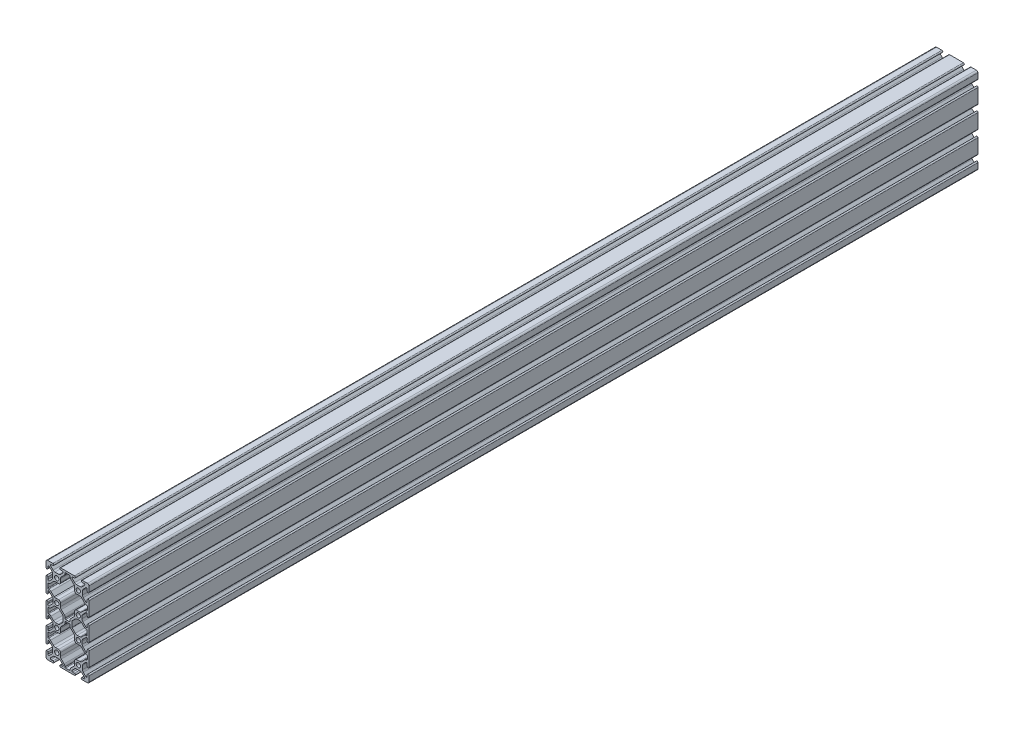
from build123d import *

# Parameters (mm, degrees)
SKETCH1_R      = 2.5
EXTRUDE1_DEPTH = 1031.646


with BuildPart() as part:
    # Sketch1 → Extrude1 (new body)
    with BuildSketch(Plane.XY):
        with BuildLine():
            Line((-8.202452575, 43.310755937), (-5.238252772, 46.27495574))
            ThreePointArc((-5.238252772, 46.27495574), (-5.03697983, 47.286823153), (-5.894799602, 47.86))
            Line((-5.894799602, 47.86), (-8.02436974, 47.86))
            ThreePointArc((-8.02436974, 47.86), (-9.09436974, 48.93), (-8.02436974, 50))
            Line((-8.02436974, 50), (-2.315834377, 50))
            Line((-2.315834377, 50), (2.315834377, 50))
            Line((2.315834377, 50), (8.02436974, 50))
            ThreePointArc((8.02436974, 50), (9.09436974, 48.93), (8.02436974, 47.86))
            Line((8.02436974, 47.86), (5.894799602, 47.86))
            ThreePointArc((5.894799602, 47.86), (5.03697983, 47.286823153), (5.238252772, 46.27495574))
            Line((5.238252772, 46.27495574), (8.202452575, 43.310755937))
            ThreePointArc((8.202452575, 43.310755937), (9.157595011, 42.672550862), (10.284262293, 42.448444577))
            Line((10.284262293, 42.448444577), (14.708234998, 42.448454152))
            ThreePointArc((14.708234998, 42.448454152), (15.83893827, 42.671117491), (16.797547425, 43.310755937))
            Line((16.797547425, 43.310755937), (19.761747228, 46.27495574))
            ThreePointArc((19.761747228, 46.27495574), (19.96302017, 47.286823153), (19.105200398, 47.86))
            Line((19.105200398, 47.86), (16.97563026, 47.86))
            ThreePointArc((16.97563026, 47.86), (15.90563026, 48.93), (16.97563026, 50))
            Line((16.97563026, 50), (21.758832238, 50))
            Line((21.758832238, 50), (23.041124805, 50))
            ThreePointArc((23.041124805, 50), (24.332005248, 49.521885571), (25, 48.318245783))
            Line((25, 48.318245783), (25, 42.082202669))
            ThreePointArc((25, 42.082202669), (23.93, 41.012202669), (22.86, 42.082202669))
            Line((22.86, 42.082202669), (22.86, 44.211772807))
            ThreePointArc((22.86, 44.211772807), (22.13773437, 44.916244594), (21.164272753, 44.651064241))
            Line((21.164272753, 44.651064241), (18.327918757, 41.814710246))
            ThreePointArc((18.327918757, 41.814710246), (17.639489034, 40.784402354), (17.397744663, 39.569071332))
            Line((17.397744663, 39.569071332), (17.397744663, 35.430928668))
            ThreePointArc((17.397744663, 35.430928668), (17.639489034, 34.215597646), (18.327918757, 33.185289754))
            Line((18.327918757, 33.185289754), (21.127116553, 30.386091959))
            ThreePointArc((21.127116553, 30.386091959), (22.233362186, 30.166046021), (22.86, 31.103875784))
            Line((22.86, 31.103875784), (22.86, 33.442202669))
            ThreePointArc((22.86, 33.442202669), (23.93, 34.512202669), (25, 33.442202669))
            Line((25, 33.442202669), (25, 29.299008941))
            Line((25, 29.299008941), (25, 21.219740648))
            Line((25, 21.219740648), (25, 17.040370729))
            ThreePointArc((25, 17.040370729), (23.904333588, 15.955956055), (22.86646371, 17.095809637))
            Line((22.86646371, 17.095809637), (22.86646371, 19.489411218))
            ThreePointArc((22.86646371, 19.489411218), (22.119482528, 20.02126145), (21.24830289, 19.735094378))
            Line((21.24830289, 19.735094378), (17.927013012, 16.4138045))
            ThreePointArc((17.927013012, 16.4138045), (17.222742213, 15.542217138), (16.865021315, 14.480286045))
            Line((16.865021315, 14.480286045), (16.865021315, 11.373754622))
            ThreePointArc((16.865021315, 11.373754622), (17.006264756, 9.974657926), (17.737790465, 8.77370355))
            Line((17.737790465, 8.77370355), (21.060805533, 5.450688482))
            ThreePointArc((21.060805533, 5.450688482), (22.48261952, 5.067456017), (22.865851985, 6.489270005))
            Line((22.865851985, 6.489270005), (22.865851985, 8.266111582))
            ThreePointArc((22.865851985, 8.266111582), (23.927171289, 9.338940293), (25, 8.277620989))
            Line((25, 8.277620989), (25, 3.7699517))
            Line((25, 3.7699517), (25, -3.7699517))
            Line((25, -3.7699517), (25, -8.277620989))
            ThreePointArc((25, -8.277620989), (23.927171289, -9.338940293), (22.865851985, -8.266111582))
            Line((22.865851985, -8.266111582), (22.865851985, -6.489270005))
            ThreePointArc((22.865851985, -6.489270005), (22.48261952, -5.067456017), (21.060805533, -5.450688482))
            Line((21.060805533, -5.450688482), (17.737790465, -8.77370355))
            ThreePointArc((17.737790465, -8.77370355), (17.006264756, -9.974657926), (16.865021315, -11.373754622))
            Line((16.865021315, -11.373754622), (16.865021315, -14.480286045))
            ThreePointArc((16.865021315, -14.480286045), (17.222742213, -15.542217138), (17.927013012, -16.4138045))
            Line((17.927013012, -16.4138045), (21.24830289, -19.735094378))
            ThreePointArc((21.24830289, -19.735094378), (22.119482528, -20.02126145), (22.86646371, -19.489411218))
            Line((22.86646371, -19.489411218), (22.86646371, -17.095809637))
            ThreePointArc((22.86646371, -17.095809637), (23.904333588, -15.955956055), (25, -17.040370729))
            Line((25, -17.040370729), (25, -21.219740648))
            Line((25, -21.219740648), (25, -29.299008941))
            Line((25, -29.299008941), (25, -33.442202669))
            ThreePointArc((25, -33.442202669), (23.93, -34.512202669), (22.86, -33.442202669))
            Line((22.86, -33.442202669), (22.86, -31.103875784))
            ThreePointArc((22.86, -31.103875784), (22.233362186, -30.166046021), (21.127116553, -30.386091959))
            Line((21.127116553, -30.386091959), (18.327918757, -33.185289754))
            ThreePointArc((18.327918757, -33.185289754), (17.639489034, -34.215597646), (17.397744663, -35.430928668))
            Line((17.397744663, -35.430928668), (17.397744663, -39.569071332))
            ThreePointArc((17.397744663, -39.569071332), (17.639489034, -40.784402354), (18.327918757, -41.814710246))
            Line((18.327918757, -41.814710246), (21.164272753, -44.651064241))
            ThreePointArc((21.164272753, -44.651064241), (22.13773437, -44.916244594), (22.86, -44.211772807))
            Line((22.86, -44.211772807), (22.86, -42.082202669))
            ThreePointArc((22.86, -42.082202669), (23.93, -41.012202669), (25, -42.082202669))
            Line((25, -42.082202669), (25, -48.318245783))
            ThreePointArc((25, -48.318245783), (24.332005248, -49.521885571), (23.041124805, -50))
            Line((23.041124805, -50), (21.758832238, -50))
            Line((21.758832238, -50), (16.97563026, -50))
            ThreePointArc((16.97563026, -50), (15.90563026, -48.93), (16.97563026, -47.86))
            Line((16.97563026, -47.86), (19.105200398, -47.86))
            ThreePointArc((19.105200398, -47.86), (19.96302017, -47.286823153), (19.761747228, -46.27495574))
            Line((19.761747228, -46.27495574), (16.797547425, -43.310755937))
            ThreePointArc((16.797547425, -43.310755937), (15.83893827, -42.671117491), (14.708234998, -42.448454152))
            Line((14.708234998, -42.448454152), (10.284262293, -42.448444577))
            ThreePointArc((10.284262293, -42.448444577), (9.157595011, -42.672550862), (8.202452575, -43.310755937))
            Line((8.202452575, -43.310755937), (5.238252772, -46.27495574))
            ThreePointArc((5.238252772, -46.27495574), (5.03697983, -47.286823153), (5.894799602, -47.86))
            Line((5.894799602, -47.86), (8.02436974, -47.86))
            ThreePointArc((8.02436974, -47.86), (9.09436974, -48.93), (8.02436974, -50))
            Line((8.02436974, -50), (2.315834377, -50))
            Line((2.315834377, -50), (-2.315834377, -50))
            Line((-2.315834377, -50), (-8.02436974, -50))
            ThreePointArc((-8.02436974, -50), (-9.09436974, -48.93), (-8.02436974, -47.86))
            Line((-8.02436974, -47.86), (-5.894799602, -47.86))
            ThreePointArc((-5.894799602, -47.86), (-5.03697983, -47.286823153), (-5.238252772, -46.27495574))
            Line((-5.238252772, -46.27495574), (-8.202452575, -43.310755937))
            ThreePointArc((-8.202452575, -43.310755937), (-9.157595011, -42.672550862), (-10.284262293, -42.448444577))
            Line((-10.284262293, -42.448444577), (-14.708234998, -42.448454152))
            ThreePointArc((-14.708234998, -42.448454152), (-15.83893827, -42.671117491), (-16.797547425, -43.310755937))
            Line((-16.797547425, -43.310755937), (-19.761747228, -46.27495574))
            ThreePointArc((-19.761747228, -46.27495574), (-19.96302017, -47.286823153), (-19.105200398, -47.86))
            Line((-19.105200398, -47.86), (-16.97563026, -47.86))
            ThreePointArc((-16.97563026, -47.86), (-15.90563026, -48.93), (-16.97563026, -50))
            Line((-16.97563026, -50), (-23.041124805, -50))
            ThreePointArc((-23.041124805, -50), (-24.332005248, -49.521885571), (-25, -48.318245783))
            Line((-25, -48.318245783), (-25, -42.082202669))
            ThreePointArc((-25, -42.082202669), (-23.93, -41.012202669), (-22.86, -42.082202669))
            Line((-22.86, -42.082202669), (-22.86, -44.211772807))
            ThreePointArc((-22.86, -44.211772807), (-22.13773437, -44.916244594), (-21.164272753, -44.651064241))
            Line((-21.164272753, -44.651064241), (-18.327918757, -41.814710246))
            ThreePointArc((-18.327918757, -41.814710246), (-17.639489034, -40.784402354), (-17.397744663, -39.569071332))
            Line((-17.397744663, -39.569071332), (-17.397744663, -35.430928668))
            ThreePointArc((-17.397744663, -35.430928668), (-17.639489034, -34.215597646), (-18.327918757, -33.185289754))
            Line((-18.327918757, -33.185289754), (-21.127116553, -30.386091959))
            ThreePointArc((-21.127116553, -30.386091959), (-22.233362186, -30.166046021), (-22.86, -31.103875784))
            Line((-22.86, -31.103875784), (-22.86, -33.442202669))
            ThreePointArc((-22.86, -33.442202669), (-23.93, -34.512202669), (-25, -33.442202669))
            Line((-25, -33.442202669), (-25, -29.299008941))
            Line((-25, -29.299008941), (-25, -21.219740648))
            Line((-25, -21.219740648), (-25, -17.040370729))
            ThreePointArc((-25, -17.040370729), (-23.904333588, -15.955956055), (-22.86646371, -17.095809637))
            Line((-22.86646371, -17.095809637), (-22.86646371, -19.489411218))
            ThreePointArc((-22.86646371, -19.489411218), (-22.119482528, -20.02126145), (-21.24830289, -19.735094378))
            Line((-21.24830289, -19.735094378), (-17.927013012, -16.4138045))
            ThreePointArc((-17.927013012, -16.4138045), (-17.222742213, -15.542217138), (-16.865021315, -14.480286045))
            Line((-16.865021315, -14.480286045), (-16.865021315, -11.373754622))
            ThreePointArc((-16.865021315, -11.373754622), (-17.006264756, -9.974657926), (-17.737790465, -8.77370355))
            Line((-17.737790465, -8.77370355), (-21.060805533, -5.450688482))
            ThreePointArc((-21.060805533, -5.450688482), (-22.48261952, -5.067456017), (-22.865851985, -6.489270005))
            Line((-22.865851985, -6.489270005), (-22.865851985, -8.266111582))
            ThreePointArc((-22.865851985, -8.266111582), (-23.927171289, -9.338940293), (-25, -8.277620989))
            Line((-25, -8.277620989), (-25, -3.7699517))
            Line((-25, -3.7699517), (-25, 3.7699517))
            Line((-25, 3.7699517), (-25, 8.277620989))
            ThreePointArc((-25, 8.277620989), (-23.927171289, 9.338940293), (-22.865851985, 8.266111582))
            Line((-22.865851985, 8.266111582), (-22.865851985, 6.489270005))
            ThreePointArc((-22.865851985, 6.489270005), (-22.48261952, 5.067456017), (-21.060805533, 5.450688482))
            Line((-21.060805533, 5.450688482), (-17.737790465, 8.77370355))
            ThreePointArc((-17.737790465, 8.77370355), (-17.006264756, 9.974657926), (-16.865021315, 11.373754622))
            Line((-16.865021315, 11.373754622), (-16.865021315, 14.480286045))
            ThreePointArc((-16.865021315, 14.480286045), (-17.222742213, 15.542217138), (-17.927013012, 16.4138045))
            Line((-17.927013012, 16.4138045), (-21.24830289, 19.735094378))
            ThreePointArc((-21.24830289, 19.735094378), (-22.119482528, 20.02126145), (-22.86646371, 19.489411218))
            Line((-22.86646371, 19.489411218), (-22.86646371, 17.095809637))
            ThreePointArc((-22.86646371, 17.095809637), (-23.904333588, 15.955956055), (-25, 17.040370729))
            Line((-25, 17.040370729), (-25, 21.219740648))
            Line((-25, 21.219740648), (-25, 29.299008941))
            Line((-25, 29.299008941), (-25, 33.442202669))
            ThreePointArc((-25, 33.442202669), (-23.93, 34.512202669), (-22.86, 33.442202669))
            Line((-22.86, 33.442202669), (-22.86, 31.103875784))
            ThreePointArc((-22.86, 31.103875784), (-22.233362186, 30.166046021), (-21.127116553, 30.386091959))
            Line((-21.127116553, 30.386091959), (-18.327918757, 33.185289754))
            ThreePointArc((-18.327918757, 33.185289754), (-17.639489034, 34.215597646), (-17.397744663, 35.430928668))
            Line((-17.397744663, 35.430928668), (-17.397744663, 39.569071332))
            ThreePointArc((-17.397744663, 39.569071332), (-17.639489034, 40.784402354), (-18.327918757, 41.814710246))
            Line((-18.327918757, 41.814710246), (-21.164272753, 44.651064241))
            ThreePointArc((-21.164272753, 44.651064241), (-22.13773437, 44.916244594), (-22.86, 44.211772807))
            Line((-22.86, 44.211772807), (-22.86, 42.082202669))
            ThreePointArc((-22.86, 42.082202669), (-23.93, 41.012202669), (-25, 42.082202669))
            Line((-25, 42.082202669), (-25, 48.318245783))
            ThreePointArc((-25, 48.318245783), (-24.332005248, 49.521885571), (-23.041124805, 50))
            Line((-23.041124805, 50), (-16.97563026, 50))
            ThreePointArc((-16.97563026, 50), (-15.90563026, 48.93), (-16.97563026, 47.86))
            Line((-16.97563026, 47.86), (-19.105200398, 47.86))
            ThreePointArc((-19.105200398, 47.86), (-19.96302017, 47.286823153), (-19.761747228, 46.27495574))
            Line((-19.761747228, 46.27495574), (-16.797547425, 43.310755937))
            ThreePointArc((-16.797547425, 43.310755937), (-15.83893827, 42.671117491), (-14.708234998, 42.448454152))
            Line((-14.708234998, 42.448454152), (-10.284262293, 42.448444577))
            ThreePointArc((-10.284262293, 42.448444577), (-9.157595011, 42.672550862), (-8.202452575, 43.310755937))
        make_face()
        with Locations((-12.5, 12.5)):
            Circle(SKETCH1_R, mode=Mode.SUBTRACT)
        with Locations((-12.5, 37.5)):
            Circle(SKETCH1_R, mode=Mode.SUBTRACT)
        with Locations((12.5, -12.5)):
            Circle(SKETCH1_R, mode=Mode.SUBTRACT)
        with Locations((12.5, -37.5)):
            Circle(SKETCH1_R, mode=Mode.SUBTRACT)
        with Locations((-12.5, -37.5)):
            Circle(SKETCH1_R, mode=Mode.SUBTRACT)
        with Locations((-12.5, -12.5)):
            Circle(SKETCH1_R, mode=Mode.SUBTRACT)
        with Locations((12.5, 37.5)):
            Circle(SKETCH1_R, mode=Mode.SUBTRACT)
        with Locations((12.5, 12.5)):
            Circle(SKETCH1_R, mode=Mode.SUBTRACT)
        with BuildLine():
            Line((-8.185773444, 12.487513796), (-8.185773444, 11.011393555))
            ThreePointArc((-8.185773444, 11.011393555), (-8.008609194, 9.643792267), (-7.268461542, 8.480219361))
            Line((-7.268461542, 8.480219361), (-3.754938975, 4.966696794))
            ThreePointArc((-3.754938975, 4.966696794), (-3.063534403, 3.923946022), (-2.832523582, 2.694310526))
            Line((-2.832523582, 2.694310526), (-2.832523582, 1.819708918))
            ThreePointArc((-2.832523582, 1.819708918), (-2.609281799, 1.280755579), (-2.07032846, 1.057513796))
            Line((-2.07032846, 1.057513796), (2.072320044, 1.057513796))
            ThreePointArc((2.072320044, 1.057513796), (2.611273383, 1.280755579), (2.834515166, 1.819708918))
            Line((2.834515166, 1.819708918), (2.834515166, 2.694310526))
            ThreePointArc((2.834515166, 2.694310526), (3.065525987, 3.923946022), (3.756930558, 4.966696794))
            Line((3.756930558, 4.966696794), (7.270453125, 8.480219361))
            ThreePointArc((7.270453125, 8.480219361), (8.010600778, 9.643792267), (8.187765028, 11.011393555))
            Line((8.187765028, 11.011393555), (8.187765028, 14.589100627))
            ThreePointArc((8.187765028, 14.589100627), (8.835059042, 16.151806613), (10.397765028, 16.799100627))
            Line((10.397765028, 16.799100627), (14.322526745, 16.799100627))
            ThreePointArc((14.322526745, 16.799100627), (14.978333775, 16.883638222), (15.602419985, 17.102146501))
            Line((15.602419985, 17.102146501), (19.298207918, 20.797934434))
            ThreePointArc((19.298207918, 20.797934434), (20.326629934, 21.485104056), (21.539736414, 21.726405938))
            Line((21.539736414, 21.726405938), (22.112655364, 21.726405938))
            ThreePointArc((22.112655364, 21.726405938), (22.651608703, 21.94964772), (22.874850486, 22.488601059))
            Line((22.874850486, 22.488601059), (22.874850486, 26.856767325))
            ThreePointArc((22.874850486, 26.856767325), (22.653840578, 27.386829201), (22.125606626, 27.612173081))
            Line((22.125606626, 27.612173081), (21.871541586, 27.612173081))
            ThreePointArc((21.871541586, 27.612173081), (20.717547023, 27.958593442), (19.776177785, 28.710613704))
            Line((19.776177785, 28.710613704), (16.387363346, 32.099428142))
            ThreePointArc((16.387363346, 32.099428142), (15.195987364, 32.790442646), (13.839798728, 33.030505467))
            Line((13.839798728, 33.030505467), (10.362350257, 33.030505467))
            ThreePointArc((10.362350257, 33.030505467), (8.799644271, 33.67779948), (8.152350257, 35.240505467))
            Line((8.152350257, 35.240505467), (8.152350257, 39.051208905))
            ThreePointArc((8.152350257, 39.051208905), (7.904533851, 40.249092372), (7.222341418, 41.26445007))
            Line((7.222341418, 41.26445007), (4.012209831, 44.474581658))
            ThreePointArc((4.012209831, 44.474581658), (3.329287545, 45.496647086), (3.089477129, 46.70225546))
            Line((3.089477129, 46.70225546), (3.089477129, 47.097840517))
            ThreePointArc((3.089477129, 47.097840517), (2.866245785, 47.636768656), (2.327317646, 47.86))
            Line((2.327317646, 47.86), (0, 47.86))
            Line((0, 47.86), (-2.327317646, 47.86))
            ThreePointArc((-2.327317646, 47.86), (-2.866245785, 47.636768656), (-3.089477129, 47.097840517))
            Line((-3.089477129, 47.097840517), (-3.089477129, 46.70225546))
            ThreePointArc((-3.089477129, 46.70225546), (-3.329287545, 45.496647086), (-4.012209831, 44.474581658))
            Line((-4.012209831, 44.474581658), (-7.222341418, 41.26445007))
            ThreePointArc((-7.222341418, 41.26445007), (-7.904533851, 40.249092372), (-8.152350257, 39.051208905))
            Line((-8.152350257, 39.051208905), (-8.152350257, 35.240505467))
            ThreePointArc((-8.152350257, 35.240505467), (-8.799644271, 33.67779948), (-10.362350257, 33.030505467))
            Line((-10.362350257, 33.030505467), (-10.389864765, 33.030505467))
            Line((-10.389864765, 33.030505467), (-13.839798728, 33.030505467))
            ThreePointArc((-13.839798728, 33.030505467), (-15.195987364, 32.790442646), (-16.387363346, 32.099428142))
            Line((-16.387363346, 32.099428142), (-19.776177785, 28.710613704))
            ThreePointArc((-19.776177785, 28.710613704), (-20.711520847, 27.964936369), (-21.856598739, 27.618962447))
            Line((-21.856598739, 27.618962447), (-22.11066378, 27.618962447))
            ThreePointArc((-22.11066378, 27.618962447), (-22.649617119, 27.395720665), (-22.872858902, 26.856767325))
            Line((-22.872858902, 26.856767325), (-22.872858902, 22.488601059))
            ThreePointArc((-22.872858902, 22.488601059), (-22.649617119, 21.94964772), (-22.11066378, 21.726405938))
            Line((-22.11066378, 21.726405938), (-21.537744831, 21.726405938))
            ThreePointArc((-21.537744831, 21.726405938), (-20.32463835, 21.485104056), (-19.296216334, 20.797934434))
            Line((-19.296216334, 20.797934434), (-15.600428402, 17.102146501))
            ThreePointArc((-15.600428402, 17.102146501), (-14.976342192, 16.883638222), (-14.320535162, 16.799100627))
            Line((-14.320535162, 16.799100627), (-10.395773444, 16.799100627))
            ThreePointArc((-10.395773444, 16.799100627), (-8.833067458, 16.151806613), (-8.185773444, 14.589100627))
            Line((-8.185773444, 14.589100627), (-8.185773444, 12.487513796))
        make_face(mode=Mode.SUBTRACT)
        with BuildLine():
            Line((-22.86, 2.484036233), (-22.86, -2.484036233))
            ThreePointArc((-22.86, -2.484036233), (-22.636758217, -3.022989573), (-22.097804878, -3.246231355))
            Line((-22.097804878, -3.246231355), (-21.843739837, -3.246231355))
            ThreePointArc((-21.843739837, -3.246231355), (-20.485171192, -3.421032102), (-19.329200619, -4.155876372))
            Line((-19.329200619, -4.155876372), (-16.293050967, -7.192026025))
            ThreePointArc((-16.293050967, -7.192026025), (-15.262743076, -7.880455748), (-14.047412053, -8.122200119))
            Line((-14.047412053, -8.122200119), (-11.24083373, -8.122200119))
            ThreePointArc((-11.24083373, -8.122200119), (-10.025502708, -7.880455748), (-8.995194816, -7.192026025))
            Line((-8.995194816, -7.192026025), (-5.327964206, -3.524795414))
            ThreePointArc((-5.327964206, -3.524795414), (-5.186657366, -3.313314782), (-5.137037002, -3.063856368))
            Line((-5.137037002, -3.063856368), (-5.137037002, 3.063856368))
            ThreePointArc((-5.137037002, 3.063856368), (-5.186657366, 3.313314782), (-5.327964206, 3.524795414))
            Line((-5.327964206, 3.524795414), (-8.995194816, 7.192026025))
            ThreePointArc((-8.995194816, 7.192026025), (-10.025502708, 7.880455748), (-11.24083373, 8.122200119))
            Line((-11.24083373, 8.122200119), (-14.047412053, 8.122200119))
            ThreePointArc((-14.047412053, 8.122200119), (-15.262743076, 7.880455748), (-16.293050967, 7.192026025))
            Line((-16.293050967, 7.192026025), (-19.329200619, 4.155876372))
            ThreePointArc((-19.329200619, 4.155876372), (-20.485171192, 3.421032102), (-21.843739837, 3.246231355))
            Line((-21.843739837, 3.246231355), (-22.097804878, 3.246231355))
            ThreePointArc((-22.097804878, 3.246231355), (-22.636758217, 3.022989573), (-22.86, 2.484036233))
        make_face(mode=Mode.SUBTRACT)
        with BuildLine():
            Line((5.137037002, 3.063856368), (5.137037002, -3.063856368))
            ThreePointArc((5.137037002, -3.063856368), (5.186657366, -3.313314782), (5.327964206, -3.524795414))
            Line((5.327964206, -3.524795414), (8.995194816, -7.192026025))
            ThreePointArc((8.995194816, -7.192026025), (10.025502708, -7.880455748), (11.24083373, -8.122200119))
            Line((11.24083373, -8.122200119), (14.047412053, -8.122200119))
            ThreePointArc((14.047412053, -8.122200119), (15.262743076, -7.880455748), (16.293050967, -7.192026025))
            Line((16.293050967, -7.192026025), (19.329200619, -4.155876372))
            ThreePointArc((19.329200619, -4.155876372), (20.485171192, -3.421032102), (21.843739837, -3.246231355))
            Line((21.843739837, -3.246231355), (22.097804878, -3.246231355))
            ThreePointArc((22.097804878, -3.246231355), (22.636758217, -3.022989573), (22.86, -2.484036233))
            Line((22.86, -2.484036233), (22.86, 2.484036233))
            ThreePointArc((22.86, 2.484036233), (22.636758217, 3.022989573), (22.097804878, 3.246231355))
            Line((22.097804878, 3.246231355), (21.843739837, 3.246231355))
            ThreePointArc((21.843739837, 3.246231355), (20.485171192, 3.421032102), (19.329200619, 4.155876372))
            Line((19.329200619, 4.155876372), (16.293050967, 7.192026025))
            ThreePointArc((16.293050967, 7.192026025), (15.262743076, 7.880455748), (14.047412053, 8.122200119))
            Line((14.047412053, 8.122200119), (11.24083373, 8.122200119))
            ThreePointArc((11.24083373, 8.122200119), (10.025502708, 7.880455748), (8.995194816, 7.192026025))
            Line((8.995194816, 7.192026025), (5.327964206, 3.524795414))
            ThreePointArc((5.327964206, 3.524795414), (5.186657366, 3.313314782), (5.137037002, 3.063856368))
        make_face(mode=Mode.SUBTRACT)
        with BuildLine():
            Line((-2.832523582, -2.694310526), (-2.832523582, -1.819708918))
            ThreePointArc((-2.832523582, -1.819708918), (-2.609281799, -1.280755579), (-2.07032846, -1.057513796))
            Line((-2.07032846, -1.057513796), (2.072320044, -1.057513796))
            ThreePointArc((2.072320044, -1.057513796), (2.611273383, -1.280755579), (2.834515166, -1.819708918))
            Line((2.834515166, -1.819708918), (2.834515166, -2.694310526))
            ThreePointArc((2.834515166, -2.694310526), (3.065525987, -3.923946022), (3.756930558, -4.966696794))
            Line((3.756930558, -4.966696794), (7.270453125, -8.480219361))
            ThreePointArc((7.270453125, -8.480219361), (8.010600778, -9.643792267), (8.187765028, -11.011393555))
            Line((8.187765028, -11.011393555), (8.187765028, -14.589100627))
            ThreePointArc((8.187765028, -14.589100627), (8.835059042, -16.151806613), (10.397765028, -16.799100627))
            Line((10.397765028, -16.799100627), (14.322526745, -16.799100627))
            ThreePointArc((14.322526745, -16.799100627), (14.978333775, -16.883638222), (15.602419985, -17.102146501))
            Line((15.602419985, -17.102146501), (19.298207918, -20.797934434))
            ThreePointArc((19.298207918, -20.797934434), (20.326629934, -21.485104056), (21.539736414, -21.726405938))
            Line((21.539736414, -21.726405938), (22.112655364, -21.726405938))
            ThreePointArc((22.112655364, -21.726405938), (22.651608703, -21.94964772), (22.874850486, -22.488601059))
            Line((22.874850486, -22.488601059), (22.874850486, -26.856767325))
            ThreePointArc((22.874850486, -26.856767325), (22.653840578, -27.386829201), (22.125606626, -27.612173081))
            Line((22.125606626, -27.612173081), (21.871541586, -27.612173081))
            ThreePointArc((21.871541586, -27.612173081), (20.717547023, -27.958593442), (19.776177785, -28.710613704))
            Line((19.776177785, -28.710613704), (16.387363346, -32.099428142))
            ThreePointArc((16.387363346, -32.099428142), (15.195987364, -32.790442646), (13.839798728, -33.030505467))
            Line((13.839798728, -33.030505467), (10.362350257, -33.030505467))
            ThreePointArc((10.362350257, -33.030505467), (8.799644271, -33.67779948), (8.152350257, -35.240505467))
            Line((8.152350257, -35.240505467), (8.152350257, -39.051208905))
            ThreePointArc((8.152350257, -39.051208905), (7.904533851, -40.249092372), (7.222341418, -41.26445007))
            Line((7.222341418, -41.26445007), (4.012209831, -44.474581658))
            ThreePointArc((4.012209831, -44.474581658), (3.329287545, -45.496647086), (3.089477129, -46.70225546))
            Line((3.089477129, -46.70225546), (3.089477129, -47.097840517))
            ThreePointArc((3.089477129, -47.097840517), (2.866245785, -47.636768656), (2.327317646, -47.86))
            Line((2.327317646, -47.86), (0, -47.86))
            Line((0, -47.86), (-2.327317646, -47.86))
            ThreePointArc((-2.327317646, -47.86), (-2.866245785, -47.636768656), (-3.089477129, -47.097840517))
            Line((-3.089477129, -47.097840517), (-3.089477129, -46.70225546))
            ThreePointArc((-3.089477129, -46.70225546), (-3.329287545, -45.496647086), (-4.012209831, -44.474581658))
            Line((-4.012209831, -44.474581658), (-7.222341418, -41.26445007))
            ThreePointArc((-7.222341418, -41.26445007), (-7.904533851, -40.249092372), (-8.152350257, -39.051208905))
            Line((-8.152350257, -39.051208905), (-8.152350257, -35.240505467))
            ThreePointArc((-8.152350257, -35.240505467), (-8.799644271, -33.67779948), (-10.362350257, -33.030505467))
            Line((-10.362350257, -33.030505467), (-10.389864765, -33.030505467))
            Line((-10.389864765, -33.030505467), (-13.839798728, -33.030505467))
            ThreePointArc((-13.839798728, -33.030505467), (-15.195987364, -32.790442646), (-16.387363346, -32.099428142))
            Line((-16.387363346, -32.099428142), (-19.776177785, -28.710613704))
            ThreePointArc((-19.776177785, -28.710613704), (-20.711520847, -27.964936369), (-21.856598739, -27.618962447))
            Line((-21.856598739, -27.618962447), (-22.11066378, -27.618962447))
            ThreePointArc((-22.11066378, -27.618962447), (-22.649617119, -27.395720665), (-22.872858902, -26.856767325))
            Line((-22.872858902, -26.856767325), (-22.872858902, -22.488601059))
            ThreePointArc((-22.872858902, -22.488601059), (-22.649617119, -21.94964772), (-22.11066378, -21.726405938))
            Line((-22.11066378, -21.726405938), (-21.537744831, -21.726405938))
            ThreePointArc((-21.537744831, -21.726405938), (-20.32463835, -21.485104056), (-19.296216334, -20.797934434))
            Line((-19.296216334, -20.797934434), (-15.600428402, -17.102146501))
            ThreePointArc((-15.600428402, -17.102146501), (-14.976342192, -16.883638222), (-14.320535162, -16.799100627))
            Line((-14.320535162, -16.799100627), (-10.395773444, -16.799100627))
            ThreePointArc((-10.395773444, -16.799100627), (-8.833067458, -16.151806613), (-8.185773444, -14.589100627))
            Line((-8.185773444, -14.589100627), (-8.185773444, -12.487513796))
            Line((-8.185773444, -12.487513796), (-8.185773444, -11.011393555))
            ThreePointArc((-8.185773444, -11.011393555), (-8.008609194, -9.643792267), (-7.268461542, -8.480219361))
            Line((-7.268461542, -8.480219361), (-3.754938975, -4.966696794))
            ThreePointArc((-3.754938975, -4.966696794), (-3.063534403, -3.923946022), (-2.832523582, -2.694310526))
        make_face(mode=Mode.SUBTRACT)
    extrude(amount=-EXTRUDE1_DEPTH)


solid = part.part
